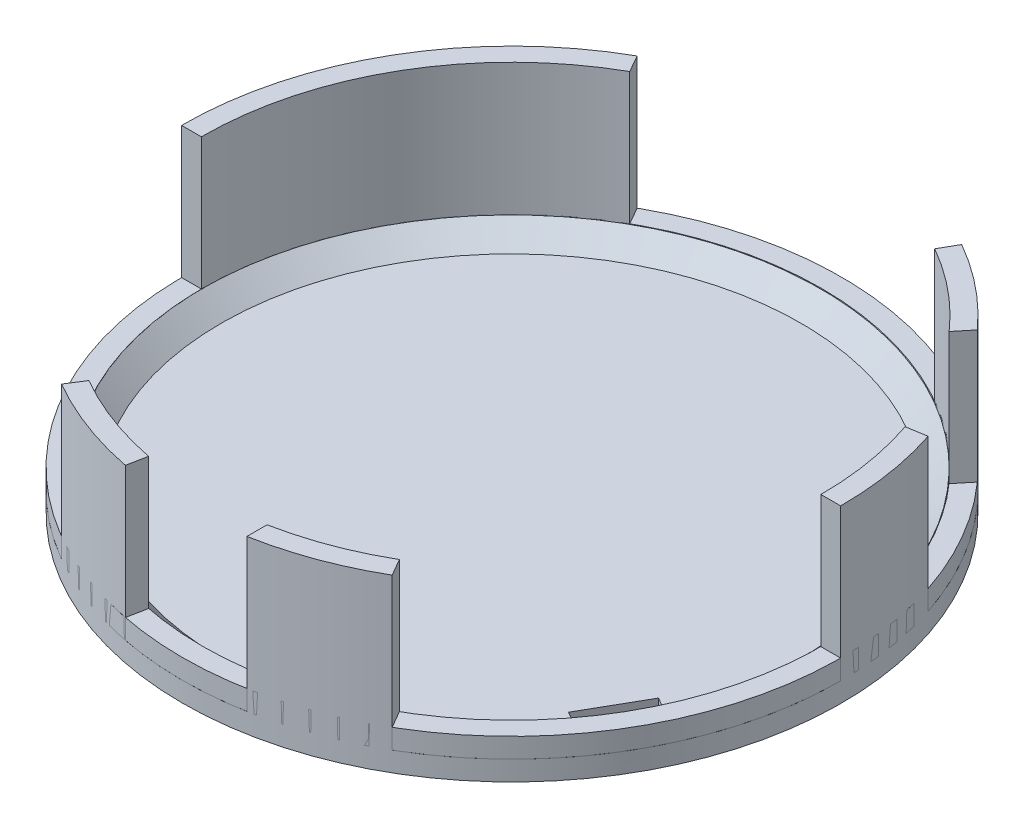
from build123d import *

# Parameters (mm, degrees)
SKETCH1_R               = 25
BOSS_EXTRUDE1_DEPTH     = 1.5
BOSS_EXTRUDE2_DEPTH     = 11.5
CUT_EXTRUDE3_DEPTH      = 15
CUT_EXTRUDE3_DEPTH_BACK = 0.001
CUT_EXTRUDE4_DEPTH      = 5.001
SKETCH9_R               = 25
SKETCH9_R_2             = 23.5
BOSS_EXTRUDE4_DEPTH     = 1.5
CUT_EXTRUDE5_DEPTH      = 4.5


with BuildPart() as part:
    # Sketch1 → Boss-Extrude1 (new body)
    with BuildSketch(Plane(origin=(0, 0, 0), x_dir=(1, 0, 0), z_dir=(0, 1, 0))):
        Circle(SKETCH1_R)
    extrude(amount=BOSS_EXTRUDE1_DEPTH)

    # Sketch3 → Boss-Extrude2 (add)
    with BuildSketch(Plane(origin=(0, 1.5, 0), x_dir=(1, 0, 0), z_dir=(0, 1, 0))):
        with BuildLine():
            ThreePointArc((25, 0), (-10.270047641, 22.793115659), (-16.562089716, -18.726910696))
            ThreePointArc((-16.562089716, -18.726910696), (10.270047641, -22.793115659), (25, 0))
        make_face()
        with BuildLine():
            ThreePointArc((23.5, 0), (9.653844782, -21.42552872), (-15.568364333, -17.603296054))
            ThreePointArc((-15.568364333, -17.603296054), (-9.653844782, 21.42552872), (23.5, 0))
        make_face(mode=Mode.SUBTRACT)
    extrude(amount=BOSS_EXTRUDE2_DEPTH)

    # Sketch4 → Cut-Extrude3 (cut, two sides: drawn at the far end of the back side and taken through both)
    with BuildSketch(Plane(origin=(0, 1.5, 0), x_dir=(1, 0, 0), z_dir=(0, 1, 0)).offset(-CUT_EXTRUDE3_DEPTH_BACK)):
        with BuildLine():
            Line((11.784714356, -20.331515132), (12.536930166, -21.629271417))
            ThreePointArc((12.536930166, -21.629271417), (21.64452184, -12.510582494), (24.999909933, -0.067106913))
            Line((24.999909933, -0.067106913), (23.499904184, -0.067106913))
            ThreePointArc((23.499904184, -0.067106913), (20.344842995, -11.761690504), (11.784714356, -20.331515132))
        make_face()
        with BuildLine():
            ThreePointArc((-4.796569027, -24.535544126), (-0.158926829, -24.99949484), (4.48423915, -24.594544095))
            Line((4.48423915, -24.594544095), (4.48423915, -23.068194538))
            ThreePointArc((4.48423915, -23.068194538), (-0.0124988, -23.499996676), (-4.508774886, -23.063411479))
            Line((-4.508774886, -23.063411479), (-4.796569027, -24.535544126))
        make_face()
        with BuildLine():
            ThreePointArc((-24.999909933, -0.067106913), (-21.650665798, -12.49994682), (-12.558177453, -21.616941945))
            Line((-12.558177453, -21.616941945), (-11.753909653, -20.349339249))
            ThreePointArc((-11.753909653, -20.349339249), (-20.335930877, -11.777092823), (-23.499904184, -0.067106913))
            Line((-23.499904184, -0.067106913), (-24.999909933, -0.067106913))
        make_face()
        with BuildLine():
            Line((22.244801118, 7.577520917), (23.743699089, 7.825391591))
            ThreePointArc((23.743699089, 7.825391591), (21.640227627, 12.518008956), (18.621106201, 16.680959321))
            Line((18.621106201, 16.680959321), (17.658496176, 15.505725162))
            ThreePointArc((17.658496176, 15.505725162), (20.341641757, 11.767226123), (22.244801118, 7.577520917))
        make_face()
        with BuildLine():
            ThreePointArc((12.42188042, 21.695549931), (0.082599021, 24.999863548), (-12.27824751, 21.777158632))
            Line((-12.27824751, 21.777158632), (-11.541552659, 20.470529114))
            ThreePointArc((-11.541552659, 20.470529114), (0.07764308, 23.499871735), (11.676567595, 20.393816936))
            Line((11.676567595, 20.393816936), (12.42188042, 21.695549931))
        make_face()
    extrude(amount=CUT_EXTRUDE3_DEPTH + CUT_EXTRUDE3_DEPTH_BACK, mode=Mode.SUBTRACT)

    # Sketch5 → Cut-Extrude4 (cut)
    with BuildSketch(Plane.XZ):
        Polygon((16.733709956, 12.446973803), (19.216503445, 8.104071987), (20.960461392, 9.101075286), (18.477667903, 13.443977102), align=None)
    extrude(amount=-CUT_EXTRUDE4_DEPTH, mode=Mode.SUBTRACT)


with BuildPart() as body_2:
    # Sketch8 → Revolve4 (revolve)
    with BuildSketch(Plane.XY.offset(0.067106913)):
        Polygon((-23.499904184, 3), (-23.499904184, 1.5), (-21.999904184, 1.5), align=None)
    revolve(axis=Axis((0, 0, 0.067106913), (0, 1, 0)))

    # Sketch10 → Cut-Extrude5 (cut)
    with BuildSketch(Plane.XZ):
        Polygon((19.216503445, 8.104071987), (20.960461392, 9.101075286), (18.477667903, 13.443977102), (16.733709956, 12.446973803), align=None)
    extrude(amount=-CUT_EXTRUDE5_DEPTH, mode=Mode.SUBTRACT)


with BuildPart() as body_3:
    # Sketch9 → Boss-Extrude4 (new body)
    with BuildSketch(Plane(origin=(0, 1.5, 0), x_dir=(1, 0, 0), z_dir=(0, 1, 0))):
        Circle(SKETCH9_R)
        Circle(SKETCH9_R_2, mode=Mode.SUBTRACT)
    extrude(amount=BOSS_EXTRUDE4_DEPTH)


solid = Compound([part.part, body_2.part, body_3.part])
